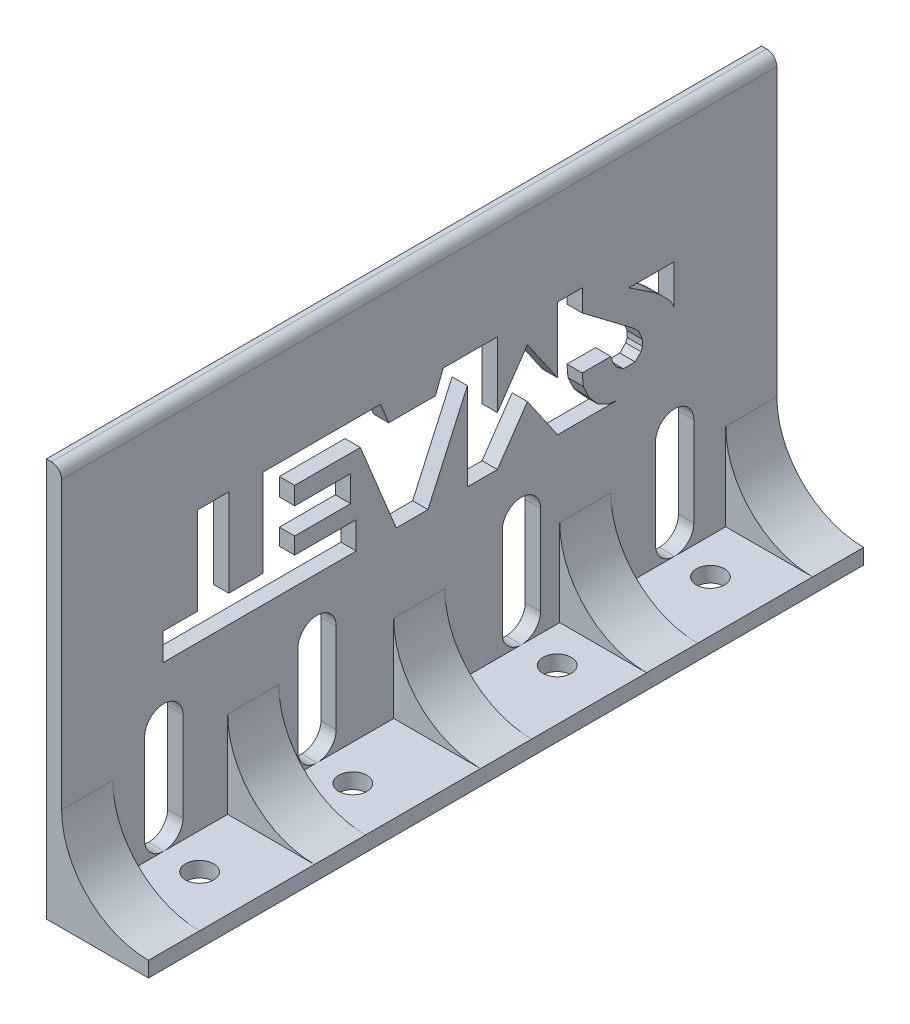
from build123d import *

# Parameters (mm, degrees)
SKETCH1_W           = 20
SKETCH1_H           = 140
BOSS_EXTRUDE1_DEPTH = 3
SKETCH2_W           = 3
SKETCH2_H           = 140
BOSS_EXTRUDE2_DEPTH = 75
SKETCH4_R           = 2.75
CUT_EXTRUDE1_DEPTH  = 10
CUT_EXTRUDE5_DEPTH  = 10
SKETCH13_W          = 7.5
SKETCH13_H          = 25
CUT_EXTRUDE6_DEPTH  = 162.161409773
BOSS_EXTRUDE3_DEPTH = 10
BOSS_EXTRUDE4_DEPTH = 5
FILLET1_R           = 3.75
BOSS_EXTRUDE5_DEPTH = 5
FILLET2_R           = 2


with BuildPart() as part:
    # Sketch1 → Boss-Extrude1 (new body)
    with BuildSketch(Plane(origin=(0, 0, 0), x_dir=(1, 0, 0), z_dir=(0, 1, 0))):
        with Locations((10, 70)):
            Rectangle(SKETCH1_W, SKETCH1_H)
    extrude(amount=BOSS_EXTRUDE1_DEPTH)

    # Sketch2 → Boss-Extrude2 (add)
    with BuildSketch(Plane(origin=(0, 3, 0), x_dir=(1, 0, 0), z_dir=(0, 1, 0))):
        with Locations((1.5, 70)):
            Rectangle(SKETCH2_W, SKETCH2_H)
    extrude(amount=BOSS_EXTRUDE2_DEPTH)

    # Sketch4 → Cut-Extrude1 (cut)
    with BuildSketch(Plane.XZ):
        with Locations(Location((10, -20, 0), (0, 0, 270))):
            Circle(SKETCH4_R)
        with Locations(Location((10, -50, 0), (0, 0, 270))):
            Circle(SKETCH4_R)
        with Locations(Location((10, -120, 0), (0, 0, 270))):
            Circle(SKETCH4_R)
        with Locations(Location((10, -90, 0), (0, 0, 270))):
            Circle(SKETCH4_R)
    extrude(amount=-CUT_EXTRUDE1_DEPTH, mode=Mode.SUBTRACT)

    # Sketch11 → Cut-Extrude5 (cut)
    with BuildSketch(Plane.ZY):
        Polygon((-19.87445306, 35.049470042), (-57.66845643, 35.049470042), (-57.66845643, 40.375700466), (-45.620710845, 40.375700466), (-45.620710845, 43.628558514), (-56.567955095, 43.628558514), (-56.567955095, 48.727655429), (-45.620710845, 48.727655429), (-45.620710845, 52.207646986), (-58.474335361, 52.207646986), (-65.4959872, 35.049470042), (-71.703981953, 35.049470042), (-79.431402399, 52.207646986), (-79.431402399, 35.049470042), (-85.289263166, 35.049470042), (-91.179988836, 43.628558514), (-97.088991148, 35.049470042), (-108.632759584, 35.049470042), (-106.964389123, 35.31022439), (-104.891781353, 36.405186985), (-103.26233135, 38.285640805), (-102.117236881, 40.724472664), (-101.911986572, 43.118576138), (-107.511545976, 43.118576138), (-108.014068376, 41.622730328), (-108.632759584, 40.724472664), (-109.956613224, 39.815464831), (-112.255625181, 39.815464831), (-113.41257384, 40.97241349), (-113.707994228, 41.740190554), (-113.707994228, 42.874973674), (-112.965179572, 44.700944573), (-112.077421007, 45.588703138), (-101.911986572, 53.280033045), (-101.911986572, 57.552931735), (-97.088991148, 57.552931735), (-97.088991148, 44.700944573), (-91.179988836, 53.280033045), (-85.289263166, 44.700944573), (-85.289263166, 57.552931735), (-74.691981497, 57.552931735), (-73.171666345, 53.601738278), (-64.027833458, 53.601738278), (-62.420466982, 57.552931735), (-39.437456147, 57.552931735), (-39.437456147, 40.375700466), (-32.711511222, 40.375700466), (-32.711511222, 57.552931735), (-26.571823468, 57.552931735), (-26.571823468, 40.375700466), (-19.87445306, 40.375700466), align=None)
        Polygon((-119.870983837, 52.978567636), (-111.030217867, 52.978567636), (-115.109674503, 50.296859936), (-115.872275446, 49.795549834), (-117.201338289, 48.727655429), (-119.05433748, 46.831756703), (-119.581300631, 46.026502002), (-119.870983837, 45.273325665), align=None)
    extrude(amount=-CUT_EXTRUDE5_DEPTH, mode=Mode.SUBTRACT)

    # Sketch13 → Cut-Extrude6 (cut, through all)
    with BuildSketch(Plane(origin=(3, 0, 0), x_dir=(0, 0, -1), z_dir=(1, 0, 0))):
        with Locations((20, 15.5)):
            Rectangle(SKETCH13_W, SKETCH13_H)
        with Locations((50, 15.5)):
            Rectangle(SKETCH13_W, SKETCH13_H)
        with Locations((90, 15.5)):
            Rectangle(SKETCH13_W, SKETCH13_H)
        with Locations((120, 15.5)):
            Rectangle(SKETCH13_W, SKETCH13_H)
    extrude(amount=-CUT_EXTRUDE6_DEPTH, mode=Mode.SUBTRACT)

    # Sketch14 → Boss-Extrude3 (add)
    with BuildSketch(Plane.XY):
        with BuildLine():
            Line((3, 3), (3, 20))
            ThreePointArc((3, 20), (7.97918472, 7.97918472), (20, 3))
            Line((20, 3), (3, 3))
        make_face()
    boss_extrude3 = extrude(amount=-BOSS_EXTRUDE3_DEPTH)

    # Mirror1: Boss-Extrude3 across plane
    add(boss_extrude3.mirror(Plane.XY.offset(-70)))

    # Sketch15 → Boss-Extrude4 (add, symmetric)
    with BuildSketch(Plane.XY.offset(-70)):
        with BuildLine():
            Line((3, 20), (3, 3))
            Line((3, 3), (20, 3))
            ThreePointArc((20, 3), (7.97918472, 7.97918472), (3, 20))
        make_face()
    extrude(amount=BOSS_EXTRUDE4_DEPTH, both=True)

    # Fillet1
    fillet1_edges = [part.edges().sort_by_distance(p)[0] for p in [
        (1.5, 3, -116.25),
        (1.5, 28, -116.25),
        (1.5, 28, -123.75),
        (1.5, 3, -123.75),
        (1.5, 3, -93.75),
        (1.5, 3, -86.25),
        (1.5, 28, -93.75),
        (1.5, 28, -86.25),
        (1.5, 3, -53.75),
        (1.5, 3, -46.25),
        (1.5, 28, -46.25),
        (1.5, 28, -53.75),
        (1.5, 3, -23.75),
        (1.5, 3, -16.25),
        (1.5, 28, -16.25),
        (1.5, 28, -23.75),
    ]]
    fillet(fillet1_edges, radius=FILLET1_R - 0.0001)  # a hair under: the kernel refuses the full size

    # Sketch16 → Boss-Extrude5 (add, symmetric)
    with BuildSketch(Plane(origin=(0, 0, -37.5), x_dir=(-1, 0, 0), z_dir=(0, 0, -1))):
        with BuildLine():
            Line((-20, 3), (-3, 3))
            Line((-3, 3), (-3, 20))
            ThreePointArc((-3, 20), (-7.97918472, 7.97918472), (-20, 3))
        make_face()
    boss_extrude5 = extrude(amount=BOSS_EXTRUDE5_DEPTH, both=True)

    # Mirror2: Boss-Extrude5 across plane
    add(boss_extrude5.mirror(Plane.XY.offset(-70)))

    # Fillet2
    fillet2_edges = [part.edges().sort_by_distance(p)[0] for p in [
        (3, 78, -70),
    ]]
    fillet(fillet2_edges, radius=FILLET2_R)


solid = part.part
